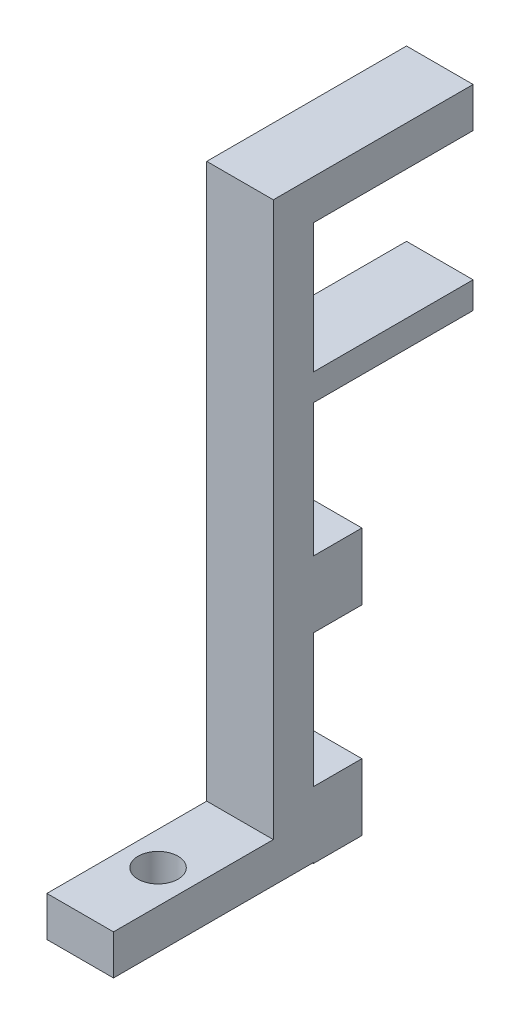
from build123d import *

# Parameters (mm, degrees)
SKETCH1_W           = 5
SKETCH1_H           = 38.6
BOSS_EXTRUDE1_DEPTH = 3
SKETCH3_W           = 5
SKETCH3_H           = 15
BOSS_EXTRUDE2_DEPTH = 3
SKETCH4_R           = 1.5
CUT_EXTRUDE1_DEPTH  = 4
SKETCH7_W           = 5
SKETCH7_H           = 15
BOSS_EXTRUDE3_DEPTH = 3
SKETCH8_W           = 5
SKETCH8_H           = 2
BOSS_EXTRUDE4_DEPTH = 12
SKETCH10_W          = 5
SKETCH10_H          = 5
BOSS_EXTRUDE5_DEPTH = 3.65


with BuildPart() as part:
    # Sketch1 → Boss-Extrude1 (new body)
    with BuildSketch(Plane.XY):
        Rectangle(SKETCH1_W, SKETCH1_H)
    extrude(amount=BOSS_EXTRUDE1_DEPTH)

    # Sketch3 → Boss-Extrude2 (add)
    with BuildSketch(Plane.XZ.offset(19.3)):
        with Locations((0, 7.5)):
            Rectangle(SKETCH3_W, SKETCH3_H)
    extrude(amount=BOSS_EXTRUDE2_DEPTH)

    # Sketch4 → Cut-Extrude1 (cut)
    with BuildSketch(Plane(origin=(0, -19.3, 0), x_dir=(1, 0, 0), z_dir=(0, 1, 0))):
        with Locations((0, -9.153210304)):
            Circle(SKETCH4_R)
    extrude(amount=-CUT_EXTRUDE1_DEPTH, mode=Mode.SUBTRACT)

    # Sketch7 → Boss-Extrude3 (add)
    with BuildSketch(Plane(origin=(0, 19.3, 0), x_dir=(1, 0, 0), z_dir=(0, 1, 0))):
        with Locations((0, 4.5)):
            Rectangle(SKETCH7_W, SKETCH7_H)
    extrude(amount=BOSS_EXTRUDE3_DEPTH)

    # Sketch8 → Boss-Extrude4 (add)
    with BuildSketch(Plane(origin=(0, 0, 0), x_dir=(-1, 0, 0), z_dir=(0, 0, -1))):
        with Locations((0, 8.6)):
            Rectangle(SKETCH8_W, SKETCH8_H)
    extrude(amount=BOSS_EXTRUDE4_DEPTH)

    # Sketch10 → Boss-Extrude5 (add)
    with BuildSketch(Plane(origin=(0, 0, 0), x_dir=(-1, 0, 0), z_dir=(0, 0, -1))):
        with Locations((0, -4.864250557)):
            Rectangle(SKETCH10_W, SKETCH10_H)
        with Locations((0, -19.864250557)):
            Rectangle(SKETCH10_W, SKETCH10_H)
    extrude(amount=BOSS_EXTRUDE5_DEPTH)


solid = part.part
